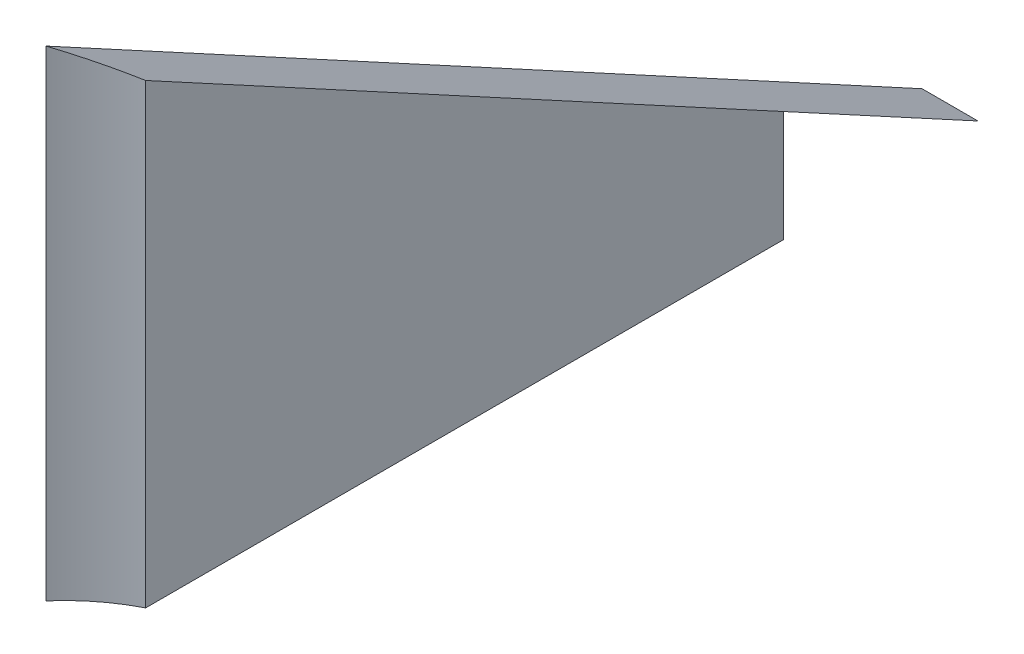
from build123d import *

# Parameters (mm, degrees)
BOSS_EXTRUDE1_DEPTH = 3.77
FILLET1_R           = 0.2
CAVITY1_DEPTH       = 32.53
CUT_EXTRUDE1_DEPTH  = 10


# Read off the part's stored shape, not the designer's step: Cavity1
with BuildPart() as part:
    # Sketch1 → Boss-Extrude1 (new body)
    with BuildSketch(Plane(origin=(0, 0, 0), x_dir=(0, 0, -1), z_dir=(1, 0, 0))):
        Polygon((0, 0), (60, 0), (0, 32.53), align=None)
    extrude(amount=BOSS_EXTRUDE1_DEPTH)

    # Fillet1
    fillet1_edges = [part.edges().sort_by_distance(p)[0] for p in [
        (1.885, 0, -60),
    ]]
    fillet(fillet1_edges, radius=FILLET1_R)

    # Cavity1 outline → Cavity1 (cut)
    with BuildSketch(Plane(origin=(0, 0, 0), x_dir=(1, 0, 0), z_dir=(0, 1, 0))):
        with BuildLine():
            Line((3.77, 0), (3.77, 3.2038331))
            ThreePointArc((3.77, 3.2038331), (1.741729711, 1.914090145), (0, 0.257679909))
            Line((0, 0.257679909), (0, 0))
            Line((0, 0), (3.77, 0))
        make_face()
    extrude(amount=CAVITY1_DEPTH, mode=Mode.SUBTRACT)

    # Sketch2 → Cut-Extrude1 (cut)
    with BuildSketch(Plane.ZY):
        Polygon((-46.188988267, 0), (-46.188988267, 7.48784154), (-59.313137704, 0.37224377), (-59.211490846, 0), align=None)
    extrude(amount=-CUT_EXTRUDE1_DEPTH, mode=Mode.SUBTRACT)


with BuildPart() as cut_extrude1_kept_piece:
    # of the separate pieces the step leaves, the one the design keeps (cut_extrude1_pieces_kept)
    add(part.part.solids().sort_by_distance((0, 0, -0.257679909))[0])


solid = cut_extrude1_kept_piece.part
